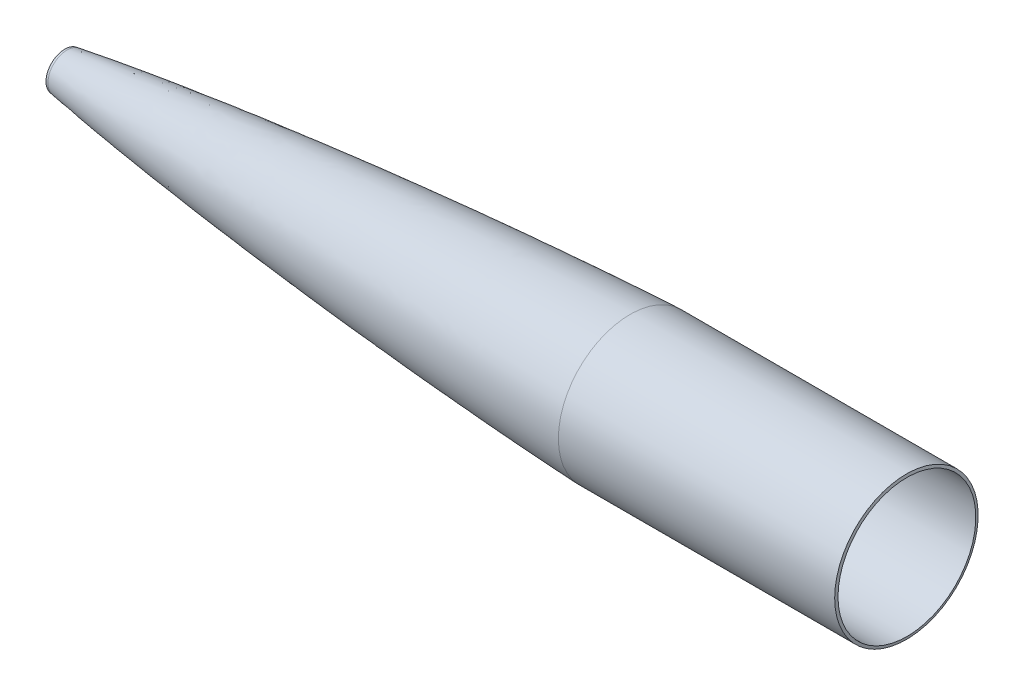
from build123d import *

# Parameters (mm, degrees)
CHAMFER1_SIZE      = 16.51
SKETCH2_R          = 12.25
CUT_EXTRUDE1_DEPTH = 165


with BuildPart() as part:
    # Sketch1 → Revolve5 (revolve)
    with BuildSketch(Plane(origin=(0, 0, 0), x_dir=(1, 0, 0), z_dir=(0, 1, 0)), mode=Mode.PRIVATE) as revolve5_sk:
        with BuildLine():
            Line((98.225852671, 21.465396338), (95.684220755, 21.057997163))
            Line((95.684220755, 21.057997163), (95.684220755, 0))
            Line((95.684220755, 0), (98.726886962, 0))
            Line((98.726886962, 0), (98.726886962, 18.330178699))
            add(Edge.make_bspline(
                [(98.726886962, 18.330178699), (113.994878644, 20.770132881), (144.577764754, 25.330670583), (205.898051252, 33.589807316), (282.72017046, 42.680521232), (375.073984944, 52.176751592), (467.547747058, 60.469235877), (560.11629344, 67.637393605), (637.322841402, 72.653277734), (694.420933949, 75.753057643), (720.626011218, 76.995143626), (731.378470364, 77.47)],
                knots=[0.119456002, 0.119456002, 0.119456002, 0.119456002, 0.174490002, 0.229524002, 0.339592002, 0.449660001, 0.559728001, 0.669796001, 0.779864001, 0.834898, 0.873185267, 0.873185267, 0.873185267, 0.873185267], degree=3))
            Line((731.378470364, 77.47), (1042.519676327, 77.47))
            Line((1042.519676327, 77.47), (1041.959838164, 80.645))
            Line((1041.959838164, 80.645), (731.308396413, 80.645))
            add(Edge.make_bspline(
                [(98.225852671, 21.465396338), (124.397667511, 25.647873666), (176.884669485, 33.109736653), (282.119502984, 46.013248572), (413.979840243, 59.356838077), (572.506921448, 72.05625987), (678.351858694, 78.306302486), (731.308396413, 80.645)],
                knots=[0.119456002, 0.119456002, 0.119456002, 0.119456002, 0.213682547, 0.307909091, 0.496362181, 0.68481527, 0.873268359, 0.873268359, 0.873268359, 0.873268359], degree=3))
        make_face()
    revolve(revolve5_sk.sketch.rotate(Axis((0, 0, 0), (1, 0, 0)), 180), axis=Axis((0, 0, 0), (1, 0, 0)))

    # Chamfer1
    # the kernel refuses this chamfer: 19.899620903, 16.51 mm, written as the material it adds along each edge
    with BuildSketch(Plane(origin=(98.726886962, 0, 0), x_dir=(0, 0, 1), z_dir=(0, 1, 0))) as chamfer1_piece_1:
        with BuildLine():
            Line((18.330178699 - CHAMFER1_SIZE, 0), (21.36915573, 19.548977031))
            ThreePointArc((21.36915573, 19.548977031), (19.91924557, 10.088803652), (18.330178699, 0))
            Line((18.330178699, 0), (18.330178699 - CHAMFER1_SIZE, 0))
        make_face()
    revolve(axis=Axis((98.726886962, 0, 0), (1, 0, 0)))

    # Sketch2 → Cut-Extrude1 (cut)
    with BuildSketch(Plane.ZY.offset(-95.684220755)):
        Circle(SKETCH2_R)
    extrude(amount=-CUT_EXTRUDE1_DEPTH, mode=Mode.SUBTRACT)


solid = part.part
